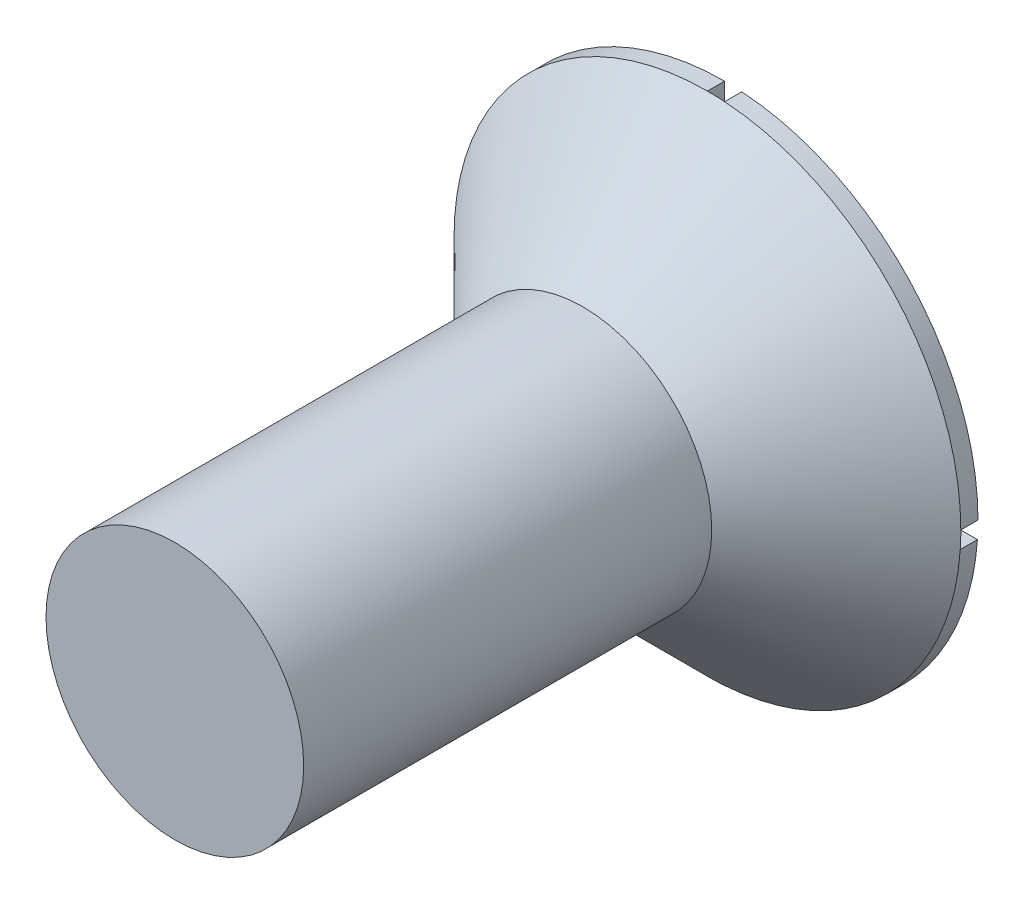
from build123d import *

# Parameters (mm, degrees)
ESQUISSE1_R                     = 1.5
BOSS_EXTRU_1_DEPTH              = 4
ESQUISSE2_R                     = 2.95
BOSS_EXTRU_2_DEPTH              = 2.4
CHANFREIN1_SIZE                 = 2.2
ESQUISSE4_W                     = 0.2
ESQUISSE4_H                     = 5.9
ESQUISSE4_W_2                   = 5.9
ESQUISSE4_H_2                   = 0.2
ENL_V_DE_MAT_EXTRU_MINCE1_DEPTH = 0.2


with BuildPart() as part:
    # Esquisse1 → Boss.-Extru.1 (new body)
    with BuildSketch(Plane.XY):
        Circle(ESQUISSE1_R)
    extrude(amount=BOSS_EXTRU_1_DEPTH)

    # Esquisse2 → Boss.-Extru.2 (add)
    with BuildSketch(Plane(origin=(0, 0, 0), x_dir=(-1, 0, 0), z_dir=(0, 0, -1))):
        Circle(ESQUISSE2_R)
    extrude(amount=BOSS_EXTRU_2_DEPTH)

    # Chanfrein1
    # the kernel refuses this chamfer: 2.2 mm, written as the material it takes off along each edge
    with BuildSketch(Plane(origin=(0, 0, 0), x_dir=(-1, 0, 0), z_dir=(0, -1, 0))) as chanfrein1_piece_1_section:
        Polygon((2.95, CHANFREIN1_SIZE), (2.95 - CHANFREIN1_SIZE, 0), (2.95, 0), align=None)
    chanfrein1_piece_1 = revolve(axis=Axis((0, 0, 0), (0, 0, -1)), mode=Mode.PRIVATE)
    chanfrein1_piece_1 = chanfrein1_piece_1 - Plane(origin=(0, 0, -1.483070645), x_dir=(1, 0, 0), z_dir=(0, 0, -1)) * Cylinder(1.5, 12, mode=Mode.PRIVATE)
    add(chanfrein1_piece_1, mode=Mode.SUBTRACT)

    # Esquisse4 → Enlèv. de mat.-Extru.-Mince1 (cut)
    with BuildSketch(Plane(origin=(0, 0, -2.4), x_dir=(-1, 0, 0), z_dir=(0, 0, -1))):
        with Locations((-0.1, 0)):
            Rectangle(ESQUISSE4_W, ESQUISSE4_H)
        with Locations((0, -0.1)):
            Rectangle(ESQUISSE4_W_2, ESQUISSE4_H_2)
    extrude(amount=-ENL_V_DE_MAT_EXTRU_MINCE1_DEPTH, mode=Mode.SUBTRACT)


solid = part.part
